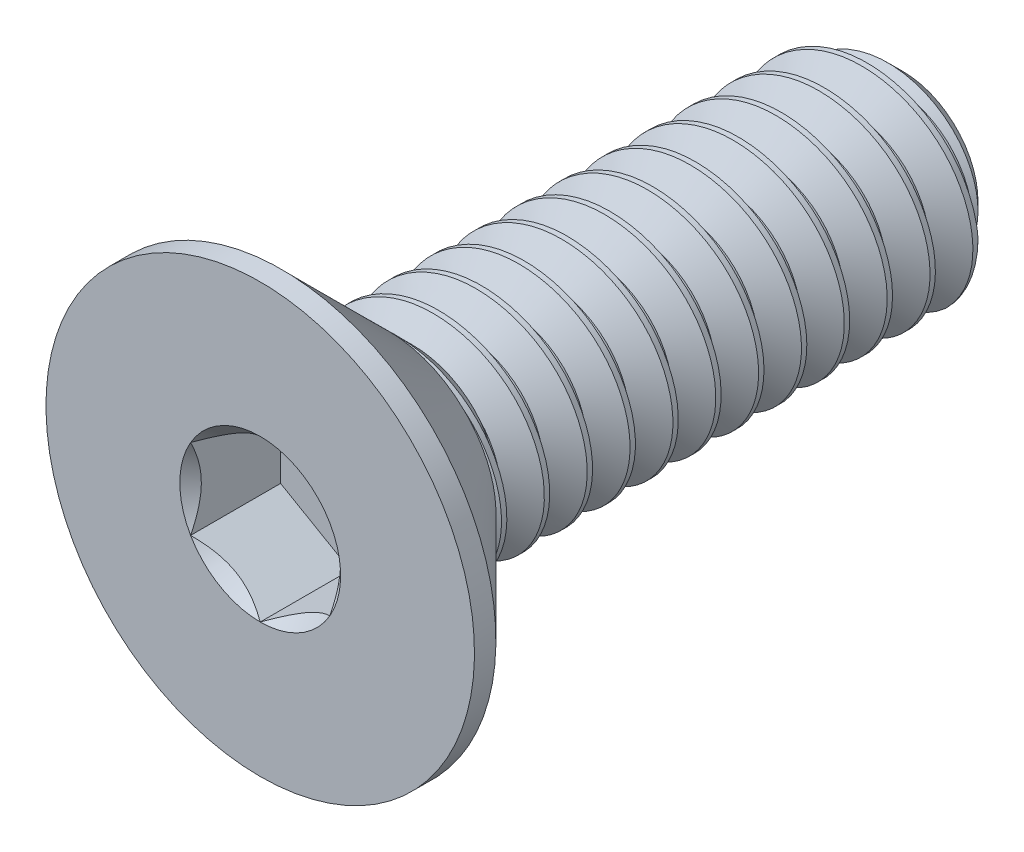
from build123d import *
from build123d.topology import SkipClean

# Parameters (mm, degrees)
SKETCH1_W          = 6
SKETCH1_H          = 1
CHAMFER1_SIZE      = 0.3
CUT_SWEEP1_PITCH   = 0.4
CUT_EXTRUDE2_DEPTH = 0.84


with BuildPart() as part:
    # Sketch1 → Revolve1 (revolve)
    with BuildSketch(Plane(origin=(0, 0, 0), x_dir=(0, 0, -1), z_dir=(1, 0, 0))):
        with Locations((3, 0.5)):
            Rectangle(SKETCH1_W, SKETCH1_H)
    revolve(axis=Axis((0, 0, -6), (0, 0, 1)))

    # Chamfer1
    chamfer1_edges = [part.edges().sort_by_distance(p)[0] for p in [
        (0, -1, -6),
    ]]
    chamfer(chamfer1_edges, length=CHAMFER1_SIZE)

    # Cut-Sweep1: arcs per turn and ends read off the stored shape
    # Cut-Sweep1: the profile of Sketch2 profile screwed along a right-hand helix through 16 turns, 6 arcs to a turn; built about Z, then put on its axis
    cut_sweep1_z = Axis((0, 0, 0), (0, 0, 1))
    cut_sweep1_corners = [(1.0003, 0, 0.000173205), (1.0003, 0, -0.350173205), (0.740192379, 0, -0.2), (0.740192379, 0, -0.15)]
    with BuildLine(mode=Mode.PRIVATE) as cut_sweep1_profile:
        Line(cut_sweep1_corners[0], cut_sweep1_corners[1])
        Line(cut_sweep1_corners[1], cut_sweep1_corners[2])
        Line(cut_sweep1_corners[2], cut_sweep1_corners[3])
        Line(cut_sweep1_corners[3], cut_sweep1_corners[0])
    cut_sweep1_cap = Face(cut_sweep1_profile.wire())
    cut_sweep1_turn_angles = [0, 30, 60, 90, 120, 150, 180, 210, 240, 270, 300, 330, 360]
    cut_sweep1_turn_weights = [1, 0.8660254037844387, 1, 0.8660254037844387, 1, 0.8660254037844387, 1, 0.8660254037844387, 1, 0.8660254037844387, 1, 0.8660254037844387, 1]
    cut_sweep1_turn_rails = [Edge.make_bspline([Vector(p[0], p[1], 0).rotate(cut_sweep1_z, cut_sweep1_turn_angles[k]) / cut_sweep1_turn_weights[k] + Vector(0, 0, p[2] + CUT_SWEEP1_PITCH * cut_sweep1_turn_angles[k] / 360) for k in range(13)], [0, 0, 0, 1, 1, 2, 2, 3, 3, 4, 4, 5, 5, 6, 6, 6], 2, cut_sweep1_turn_weights) for p in cut_sweep1_corners]
    cut_sweep1_turn_sides = [Face.make_surface_from_curves(cut_sweep1_turn_rails[p[0]], cut_sweep1_turn_rails[p[1]]) for p in [(0, 1), (1, 2), (2, 3), (3, 0)]]
    cut_sweep1 = Plane(origin=(0, 0, -6), x_dir=(0, 1, 0), z_dir=(0, 0, 1)) * Solid(Shell([*[p.moved(Location((0, 0, CUT_SWEEP1_PITCH * i))) for i in range(16) for p in cut_sweep1_turn_sides], cut_sweep1_cap, cut_sweep1_cap.rotate(cut_sweep1_z, 5760).moved(Location((0, 0, CUT_SWEEP1_PITCH * 5760 / 360)))]))
    add(cut_sweep1, mode=Mode.SUBTRACT)

    # Sketch7 → Revolve2 (revolve)
    with BuildSketch(Plane(origin=(0, 0, 0), x_dir=(0, 0, -1), z_dir=(1, 0, 0)), mode=Mode.PRIVATE) as revolve2_sk:
        Polygon((0, 2), (0.2, 2), (1.2, 1), (1.2, 0), (0, 0), align=None)
    revolve(revolve2_sk.sketch.rotate(Axis((0, 0, 0), (0, 0, -1)), 189.336081704), axis=Axis((0, 0, 0), (0, 0, -1)))

    # Boss-Extrude1 cone 1 section (through the dimple's axis) → Boss-Extrude1 (revolve)
    with SkipClean():  # the faces are left unmerged after this step: merging them gives an invalid solid
        with BuildSketch(Plane(origin=(0, 0, -1.2), x_dir=(0, -1, 0), z_dir=(1, 0, 0))):
            Polygon((0, 0), (1, 0), (0, 1), align=None)
        revolve(axis=Axis((0, 0, -1.2), (0, 0, -1)))

    # Sketch5 → Cut-Extrude2 (cut)
    with SkipClean():  # the faces are left unmerged after this step: merging them gives an invalid solid
        with BuildSketch(Plane.XY):
            Polygon((0.65, -0.375277675), (0.65, 0.375277675), (0, 0.75055535), (-0.65, 0.375277675), (-0.65, -0.375277675), (0, -0.75055535), align=None)
        extrude(amount=-CUT_EXTRUDE2_DEPTH, mode=Mode.SUBTRACT)

    # Cut-Extrude3 cone 1 section (through the dimple's axis) → Cut-Extrude3 (revolve, cut)
    with SkipClean():  # the faces are left unmerged after this step: merging them gives an invalid solid
        with BuildSketch(Plane(origin=(0, 0, 0), x_dir=(0, -1, 0), z_dir=(1, 0, 0))):
            Polygon((0, 0), (0.75055535, 0), (0, 0.75055535), align=None)
        revolve(axis=Axis((0, 0, 0), (0, 0, -1)), mode=Mode.SUBTRACT)


solid = part.part
